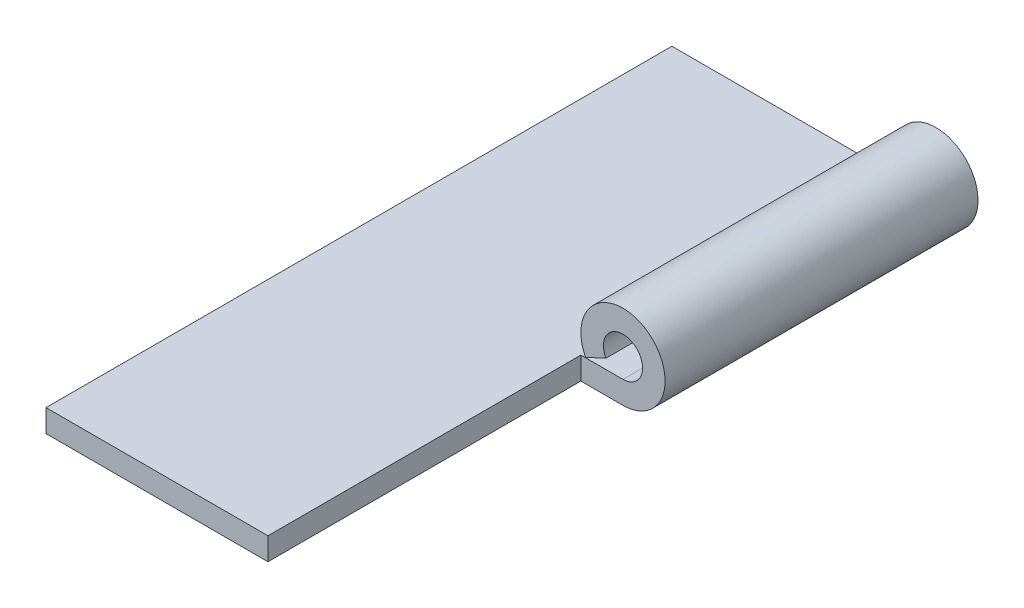
from build123d import *

# Parameters (mm, degrees)
EXTRUDE1_DEPTH     = 50.8
SKETCH2_W          = 6.8326
SKETCH2_H          = 25.4
CUT_EXTRUDE4_DEPTH = 56.557383842


with BuildPart() as part:
    # Sketch1 → Extrude1 (new body)
    with BuildSketch(Plane.XY):
        with BuildLine():
            Line((-21.43125, 0), (0, 0))
            ThreePointArc((0, 0), (1.779677423, 6.332436821), (-3.038247732, 1.8542))
            Line((-3.038247732, 1.8542), (-1.378132955, 2.628324234))
            ThreePointArc((-1.378132955, 2.628324234), (0.796631885, 4.789447439), (0, 1.8288))
            Line((0, 1.8288), (-21.43125, 1.8288))
            Line((-21.43125, 1.8288), (-21.43125, 0))
        make_face()
    extrude(amount=-EXTRUDE1_DEPTH)

    # Sketch2 → Cut-Extrude4 (cut, through all)
    with BuildSketch(Plane(origin=(0, 0, 0), x_dir=(1, 0, 0), z_dir=(0, 1, 0))):
        with Locations((0, 12.7)):
            Rectangle(SKETCH2_W, SKETCH2_H)
    extrude(amount=CUT_EXTRUDE4_DEPTH, mode=Mode.SUBTRACT)


solid = part.part
